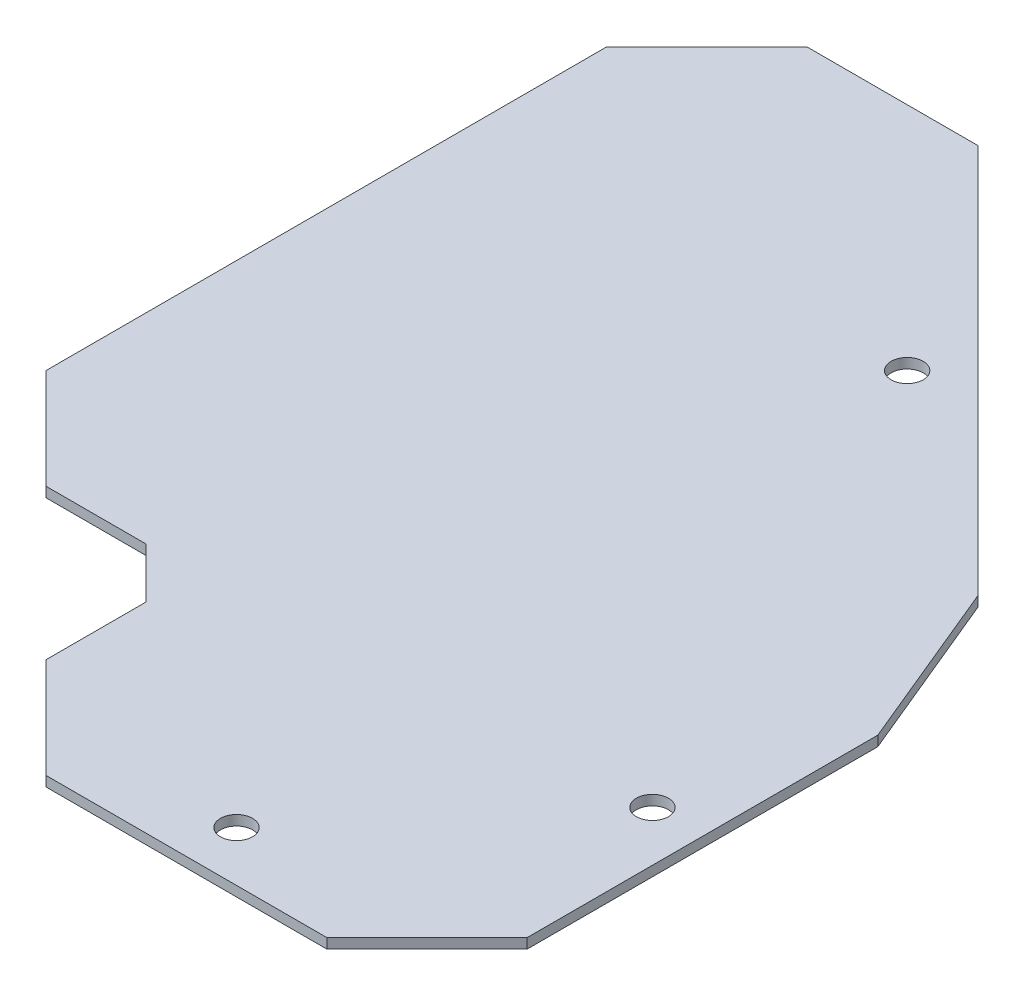
from build123d import *

# Parameters (mm, degrees)
EXTRUDE_1_DEPTH     = 1
SKETCH_2_W          = 5
SKETCH_2_H          = 30
CUT_EXTRUDE_1_DEPTH = 10
CHAMFER_1_SIZE      = 10
CHAMFER_1_SIZE_2    = 7.071067812
CHAMFER_2_SIZE      = 10
SKETCH_3_R          = 1.6
CUT_EXTRUDE_2_DEPTH = 10
SKETCH_4_W          = 20
SKETCH_4_H          = 75.961940777
EXTRUDE_2_DEPTH     = 1
CHAMFER_3_SIZE      = 10


with BuildPart() as part:
    # 草图1 → 凸台-拉伸1 (new body)
    with BuildSketch(Plane(origin=(0, 0, 0), x_dir=(1, 0, 0), z_dir=(0, 1, 0))):
        Polygon((0, 0), (53.033008589, 0), (53.033008589, 55), (0, 108.033008589), align=None)
    extrude(amount=EXTRUDE_1_DEPTH)

    # 草图2 → 切除-拉伸1 (cut)
    with BuildSketch(Plane.XZ):
        with Locations((2.5, -15)):
            Rectangle(SKETCH_2_W, SKETCH_2_H)
    extrude(amount=-CUT_EXTRUDE_1_DEPTH, mode=Mode.SUBTRACT)

    # 倒角1
    # the kernel refuses this chamfer: 10, 7.071067812 mm, written as the material it adds along each edge
    with BuildSketch(Plane(origin=(5, 0, -30), x_dir=(0.027495876610586403, 0, 0.9996219169112968), z_dir=(0, 1, 0))) as chamfer_1_piece_1_section:
        Polygon((CHAMFER_1_SIZE * 0.999621916911, -CHAMFER_1_SIZE * 0.0274958766106), (-CHAMFER_1_SIZE * 0.0274958766106, -CHAMFER_1_SIZE * 0.999621916911), (0, 0), align=None)
    chamfer_1_piece_1 = extrude(amount=1, mode=Mode.PRIVATE)
    chamfer_1_piece_1 = split(chamfer_1_piece_1, bisect_by=Plane(origin=(0, 0.5, -26.065989159), z_dir=(1, 0, 0)), keep=Keep.TOP, mode=Mode.PRIVATE)
    add(chamfer_1_piece_1)
    # the kernel refuses this chamfer: 10, 7.071067812 mm, written as the material it takes off along each edge
    with BuildSketch(Plane(origin=(0, -25.71682988, -108.033008589), x_dir=(-0.056478249472490825, 0, 0.9984038297885897), z_dir=(0, 1, 0))) as chamfer_1_2_piece_1:
        Polygon((CHAMFER_1_SIZE_2 * 0.99840382977, CHAMFER_1_SIZE_2 * 0.0564782494714), (CHAMFER_1_SIZE * 0.666041965215, CHAMFER_1_SIZE * 0.745914271598), (0, 0), align=None)
    extrude(amount=52.433659759, mode=Mode.SUBTRACT)
    with BuildSketch(Plane(origin=(5, -25.71682988, 0), x_dir=(0.9996219169112968, 0, 0.027495876610586372), z_dir=(0, 1, 0))) as chamfer_1_2_piece_2:
        Polygon((CHAMFER_1_SIZE * 0.999621916911, CHAMFER_1_SIZE * 0.0274958766106), (-CHAMFER_1_SIZE * 0.0274958766106, CHAMFER_1_SIZE * 0.999621916911), (0, 0), align=None)
    extrude(amount=52.433659759, mode=Mode.SUBTRACT)
    with BuildSketch(Plane(origin=(53.033008589, -25.71682988, 0), x_dir=(-0.9996219169112968, 0, 0.027495876610586372), z_dir=(0, 1, 0))) as chamfer_1_2_piece_3:
        Polygon((CHAMFER_1_SIZE * 0.999621916911, -CHAMFER_1_SIZE * 0.0274958766106), (-CHAMFER_1_SIZE * 0.0274958766106, -CHAMFER_1_SIZE * 0.999621916911), (0, 0), align=None)
    extrude(amount=52.433659759, mode=Mode.SUBTRACT)

    # 倒角2
    chamfer_2_edges = [part.edges().sort_by_distance(p)[0] for p in [
        (53.033008589, 0.5, -55),
    ]]
    chamfer(chamfer_2_edges, length=CHAMFER_2_SIZE)

    # 草图3 → 切除-拉伸2 (cut)
    with BuildSketch(Plane.XZ):
        with Locations(Location((22.980970389, -77.980970389, 0), (0, 0, 270))):
            Circle(SKETCH_3_R)
        with Locations(Location((48.033008589, -27.5, 0), (0, 0, 270))):
            Circle(SKETCH_3_R)
        with Locations(Location((29.016504294, -5, 0), (0, 0, 270))):
            Circle(SKETCH_3_R)
    extrude(amount=-CUT_EXTRUDE_2_DEPTH, mode=Mode.SUBTRACT)

    # 草图4 → 凸台-拉伸2 (add)
    with BuildSketch(Plane.XZ):
        with Locations((-10, -62.980970389)):
            Rectangle(SKETCH_4_W, SKETCH_4_H)
    extrude(amount=-EXTRUDE_2_DEPTH)

    # 倒角3
    chamfer_3_edges = [part.edges().sort_by_distance(p)[0] for p in [
        (-20, 0.5, -25),
        (-20, 0.5, -100.961940777),
    ]]
    chamfer(chamfer_3_edges, length=CHAMFER_3_SIZE)


solid = part.part
